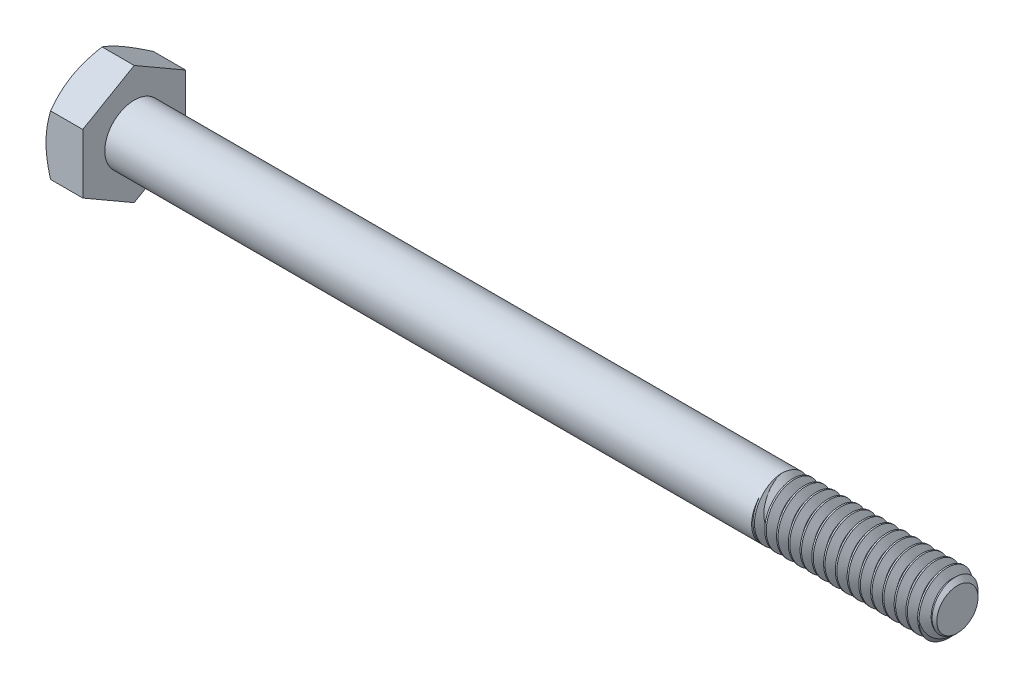
from build123d import *
from build123d.topology import SkipClean

# Parameters (mm, degrees)
SKETCH5_R           = 3.175
BOSS_EXTRUDE3_DEPTH = 88.9
CHAMFER1_SIZE       = 0.9525
CUT_SWEEP1_PITCH    = 1.27
BOSS_EXTRUDE4_DEPTH = 3.96875
SKETCH8_OUTSIDE_W   = 358.506
SKETCH8_OUTSIDE_H   = 360.226
SKETCH8_OUTSIDE_R   = 5.55625
CUT_EXTRUDE3_DEPTH  = 94.255773072
CUT_EXTRUDE3_DRAFT  = -60


with BuildPart() as part:
    # Sketch5 → Boss-Extrude3 (new body)
    with BuildSketch(Plane(origin=(46.434375, 0, 0), x_dir=(0, 0, -1), z_dir=(1, 0, 0))):
        Circle(SKETCH5_R)
    extrude(amount=-BOSS_EXTRUDE3_DEPTH)

    # Chamfer1
    chamfer1_edges = [part.edges().sort_by_distance(p)[0] for p in [
        (46.434375, 0, 3.175),
    ]]
    chamfer(chamfer1_edges, length=CHAMFER1_SIZE)

    # Cut-Sweep1: arcs per turn and ends read off the stored shape
    # Cut-Sweep1: the profile of Sketch10 profile screwed along a right-hand helix through 71 turns, 6 arcs to a turn; built about Z, then put on its axis
    cut_sweep1_z = Axis((0, 0, 0), (0, 0, 1))
    cut_sweep1_corners = [(3.1753, 0, 0.000173205), (2.350110803, 0, -0.47625), (2.350110803, 0, -0.635), (3.1753, 0, -1.111423205)]
    with BuildLine(mode=Mode.PRIVATE) as cut_sweep1_profile:
        Line(cut_sweep1_corners[0], cut_sweep1_corners[1])
        Line(cut_sweep1_corners[1], cut_sweep1_corners[2])
        Line(cut_sweep1_corners[2], cut_sweep1_corners[3])
        Line(cut_sweep1_corners[3], cut_sweep1_corners[0])
    cut_sweep1_cap = Face(cut_sweep1_profile.wire())
    cut_sweep1_turn_angles = [0, 30, 60, 90, 120, 150, 180, 210, 240, 270, 300, 330, 360]
    cut_sweep1_turn_weights = [1, 0.8660254037844387, 1, 0.8660254037844387, 1, 0.8660254037844387, 1, 0.8660254037844387, 1, 0.8660254037844387, 1, 0.8660254037844387, 1]
    cut_sweep1_turn_rails = [Edge.make_bspline([Vector(p[0], p[1], 0).rotate(cut_sweep1_z, cut_sweep1_turn_angles[k]) / cut_sweep1_turn_weights[k] + Vector(0, 0, p[2] + CUT_SWEEP1_PITCH * cut_sweep1_turn_angles[k] / 360) for k in range(13)], [0, 0, 0, 1, 1, 2, 2, 3, 3, 4, 4, 5, 5, 6, 6, 6], 2, cut_sweep1_turn_weights) for p in cut_sweep1_corners]
    cut_sweep1_turn_sides = [Face.make_surface_from_curves(cut_sweep1_turn_rails[p[0]], cut_sweep1_turn_rails[p[1]]) for p in [(0, 1), (1, 2), (2, 3), (3, 0)]]
    cut_sweep1 = Plane(origin=(46.434375, 0, 0), x_dir=(0, 1, 0), z_dir=(-1, 0, 0)) * Solid(Shell([*[p.moved(Location((0, 0, CUT_SWEEP1_PITCH * i))) for i in range(71) for p in cut_sweep1_turn_sides], cut_sweep1_cap, cut_sweep1_cap.rotate(cut_sweep1_z, 25560).moved(Location((0, 0, CUT_SWEEP1_PITCH * 25560 / 360)))]))
    add(cut_sweep1, mode=Mode.SUBTRACT)

    # Sketch11 → Revolve1 (revolve)
    with SkipClean():  # the faces are left unmerged after this step: merging them gives an invalid solid
        with BuildSketch(Plane.XY, mode=Mode.PRIVATE) as revolve1_sk:
            Polygon((-42.465625, 3.175), (-42.465625, 0), (30.559375, 0), (27.384375, 3.175), align=None)
        revolve(revolve1_sk.sketch.rotate(Axis((-42.465625, 0, 0), (1, 0, 0)), 90), axis=Axis((-42.465625, 0, 0), (1, 0, 0)))

    # Sketch6 → Boss-Extrude4 (add)
    with BuildSketch(Plane.ZY.offset(42.465625)):
        Polygon((5.55625, 3.207902433), (0, 6.415804866), (-5.55625, 3.207902433), (-5.55625, -3.207902433), (0, -6.415804866), (5.55625, -3.207902433), align=None)
    extrude(amount=BOSS_EXTRUDE4_DEPTH)


with BuildPart() as cut_extrude3_tool:
    # Sketch8 outside → Cut-Extrude3 (with draft: the straight prism first)
    with BuildSketch(Plane.ZY.offset(46.434375)):
        Rectangle(SKETCH8_OUTSIDE_W, SKETCH8_OUTSIDE_H)
        Circle(SKETCH8_OUTSIDE_R, mode=Mode.SUBTRACT)
    extrude(amount=-CUT_EXTRUDE3_DEPTH)
    # Cut-Extrude3: the draft: its side faces are tilted about the plane it starts from
    cut_extrude3_sides = [cut_extrude3_tool.faces().sort_by_distance(p)[0] for p in [
        (0.693511536, -180.113, 0),
        (0.693511536, 0, 179.253),
        (0.693511536, 180.113, 0),
        (0.693511536, 0, -179.253),
        (0.693511536, 0, -5.55625),
    ]]
    draft(cut_extrude3_sides, Plane.ZY.offset(46.434375), CUT_EXTRUDE3_DRAFT)


with BuildPart() as part_1:
    add(part.part)

    # Cut-Extrude3: cut by cut_extrude3_tool
    add(cut_extrude3_tool.part, mode=Mode.SUBTRACT)


solid = part_1.part
